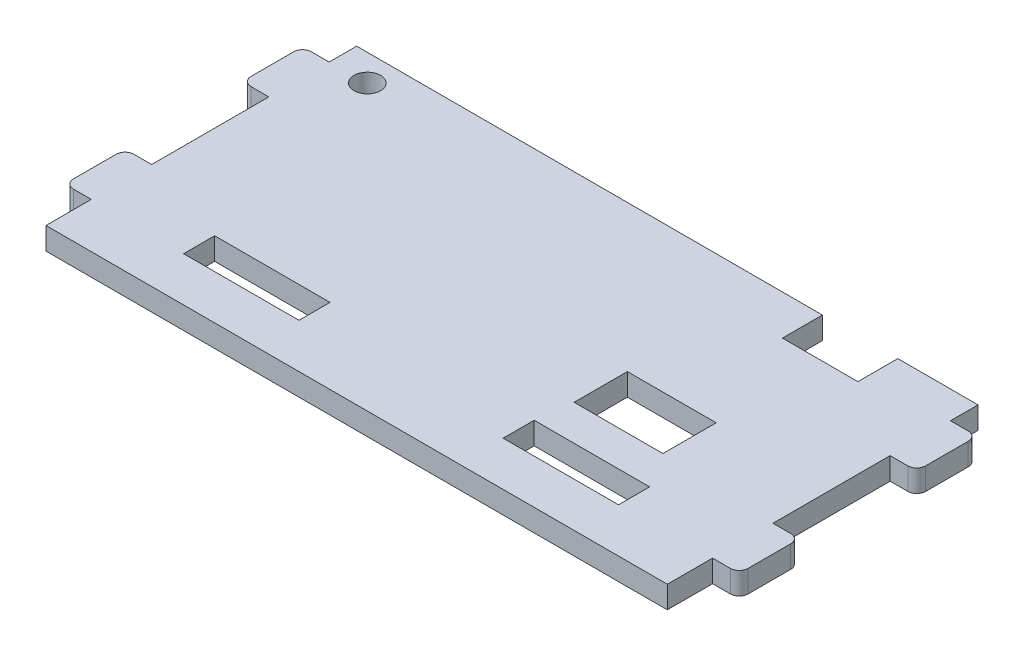
from build123d import *

# Parameters (mm, degrees)
SKETCH_1_W          = 76
SKETCH_1_H          = 35
EXTRUDE_1_DEPTH     = 2.5
SKETCH_2_W          = 13
SKETCH_2_H          = 3.5
CUT_EXTRUDE_1_DEPTH = 42.910619179
SKETCH_3_W          = 3
SKETCH_3_H          = 5.1
SKETCH_3_H_2        = 3.1
SKETCH_3_H_3        = 13.2
CUT_EXTRUDE_2_DEPTH = 42.910619179
FILLET_1_R          = 1
SKETCH_4_R          = 1.5
SKETCH_4_W          = 8.5
SKETCH_4_H          = 4.5
CUT_EXTRUDE_3_DEPTH = 42.910619179
SKETCH_5_W          = 10
SKETCH_5_H          = 6
CUT_EXTRUDE_4_DEPTH = 42.910619179


with BuildPart() as part:
    # 草图1 → 凸台-拉伸1 (new body)
    with BuildSketch(Plane(origin=(0, 0, 0), x_dir=(1, 0, 0), z_dir=(0, 1, 0))):
        Rectangle(SKETCH_1_W, SKETCH_1_H)
    extrude(amount=EXTRUDE_1_DEPTH)

    # 草图2 → 切除-拉伸1 (cut, through all)
    with BuildSketch(Plane(origin=(0, 2.5, 0), x_dir=(1, 0, 0), z_dir=(0, 1, 0))):
        with Locations((-18, -10.75)):
            Rectangle(SKETCH_2_W, SKETCH_2_H)
        with Locations((18, -10.75)):
            Rectangle(SKETCH_2_W, SKETCH_2_H)
    extrude(amount=-CUT_EXTRUDE_1_DEPTH, mode=Mode.SUBTRACT)

    # 草图3 → 切除-拉伸2 (cut, through all)
    with BuildSketch(Plane(origin=(0, 2.5, 0), x_dir=(1, 0, 0), z_dir=(0, 1, 0))):
        with Locations((-36.5, -14.95)):
            Rectangle(SKETCH_3_W, SKETCH_3_H)
        with Locations((-36.5, 15.95)):
            Rectangle(SKETCH_3_W, SKETCH_3_H_2)
        with Locations((-36.5, 1)):
            Rectangle(SKETCH_3_W, SKETCH_3_H_3)
        with Locations((36.5, -14.95)):
            Rectangle(SKETCH_3_W, SKETCH_3_H)
        with Locations((36.5, 1)):
            Rectangle(SKETCH_3_W, SKETCH_3_H_3)
        with Locations((36.5, 15.95)):
            Rectangle(SKETCH_3_W, SKETCH_3_H_2)
    extrude(amount=-CUT_EXTRUDE_2_DEPTH, mode=Mode.SUBTRACT)

    # 圆角1
    fillet_1_edges = [part.edges().sort_by_distance(p)[0] for p in [
        (38, 1.25, -14.4),
        (38, 1.25, -7.6),
        (38, 1.25, 5.6),
        (38, 1.25, 12.4),
        (-38, 1.25, 12.4),
        (-38, 1.25, 5.6),
        (-38, 1.25, -7.6),
        (-38, 1.25, -14.4),
    ]]
    fillet(fillet_1_edges, radius=FILLET_1_R)

    # 草图4 → 切除-拉伸3 (cut, through all)
    with BuildSketch(Plane(origin=(0, 2.5, 0), x_dir=(1, 0, 0), z_dir=(0, 1, 0))):
        with Locations((-30.8, 14.5)):
            Circle(SKETCH_4_R)
        with Locations((21.718135054, 15.25)):
            Rectangle(SKETCH_4_W, SKETCH_4_H)
    extrude(amount=-CUT_EXTRUDE_3_DEPTH, mode=Mode.SUBTRACT)

    # 草图5 → 切除-拉伸4 (cut, through all)
    with BuildSketch(Plane(origin=(0, 2.5, 0), x_dir=(1, 0, 0), z_dir=(0, 1, 0))):
        with Locations((17, -2)):
            Rectangle(SKETCH_5_W, SKETCH_5_H)
    extrude(amount=-CUT_EXTRUDE_4_DEPTH, mode=Mode.SUBTRACT)


solid = part.part
